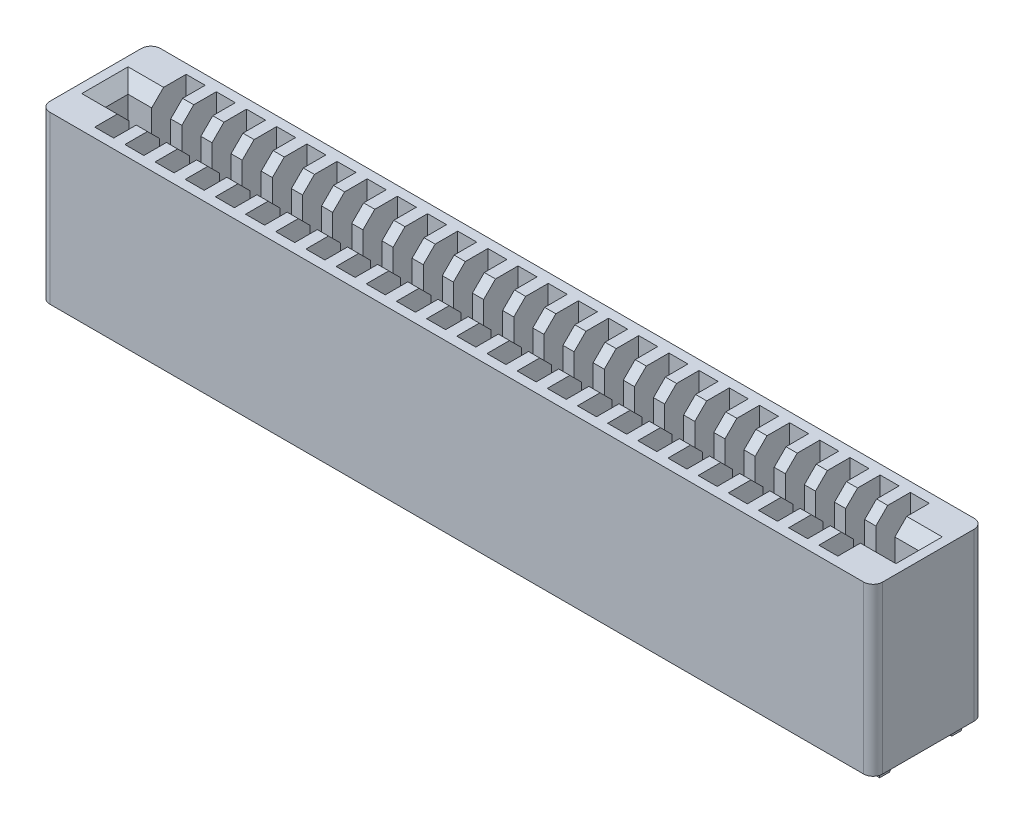
from build123d import *

# Parameters (mm, degrees)
BOSS_EXTRUDE1_DEPTH       = 14
SKETCH2_W                 = 66.54
SKETCH2_H                 = 1.9
CUT_EXTRUDE1_DEPTH        = 7.3
CHAMFER1_SIZE             = 1
SKETCH3_W                 = 1.6
SKETCH3_H                 = 7.7
CUT_EXTRUDE2_DEPTH        = 7.3
LPATTERN1_COUNT           = 25
LPATTERN1_PITCH           = 2.54
SKETCH4_W                 = 1.8
SKETCH4_H                 = 1.3
BOSS_EXTRUDE2_DEPTH       = 0.8
DRAFT5_ANGLE              = 30
DRAFT5_OF_MIRROR1_2_ANGLE = 30
SKETCH5_W                 = 64.2
SKETCH5_H                 = 3
CUT_EXTRUDE3_DEPTH        = 3.5
SKETCH6_W                 = 1
SKETCH6_H                 = 3
BOSS_EXTRUDE3_DEPTH       = 3.5
LPATTERN2_COUNT           = 25
LPATTERN2_PITCH           = 2.54
SKETCH7_W                 = 0.9
SKETCH7_H                 = 0.4
CUT_EXTRUDE4_DEPTH        = 39.027950247
LPATTERN3_COUNT           = 25
LPATTERN3_PITCH           = 2.54
LPATTERN3_COUNT_DIR2      = 2
LPATTERN3_PITCH_DIR2      = 5.08
CUT_EXTRUDE5_DEPTH        = 1.6
LPATTERN4_COUNT           = 25
LPATTERN4_PITCH           = 2.54


# Read off the part's stored shape, not the designer's step: Mirror2
with BuildPart() as part:
    # Sketch1 → Boss-Extrude1 (new body)
    with BuildSketch(Plane(origin=(0, 0, 0), x_dir=(1, 0, 0), z_dir=(0, 1, 0))):
        with BuildLine():
            Line((-34.25, 4.65), (34.25, 4.65))
            ThreePointArc((34.25, 4.65), (34.815685425, 4.415685425), (35.05, 3.85))
            Line((35.05, 3.85), (35.05, -3.85))
            ThreePointArc((35.05, -3.85), (34.815685425, -4.415685425), (34.25, -4.65))
            Line((34.25, -4.65), (-34.25, -4.65))
            ThreePointArc((-34.25, -4.65), (-34.815685425, -4.415685425), (-35.05, -3.85))
            Line((-35.05, -3.85), (-35.05, 3.85))
            ThreePointArc((-35.05, 3.85), (-34.815685425, 4.415685425), (-34.25, 4.65))
        make_face()
    extrude(amount=BOSS_EXTRUDE1_DEPTH)

    # Sketch2 → Cut-Extrude1 (cut)
    with BuildSketch(Plane(origin=(0, 14, 0), x_dir=(1, 0, 0), z_dir=(0, 1, 0))):
        Rectangle(SKETCH2_W, SKETCH2_H)
    extrude(amount=-CUT_EXTRUDE1_DEPTH, mode=Mode.SUBTRACT)

    # Chamfer1
    chamfer1_edges = [part.edges().sort_by_distance(p)[0] for p in [
        (33.27, 14, 0),
        (0, 14, -0.95),
        (-33.27, 14, 0),
        (0, 14, 0.95),
    ]]
    chamfer(chamfer1_edges, length=CHAMFER1_SIZE)

    # Sketch3 → Cut-Extrude2 (cut)
    with BuildSketch(Plane(origin=(0, 14, 0), x_dir=(1, 0, 0), z_dir=(0, 1, 0))):
        with Locations((-30.48, 0)):
            Rectangle(SKETCH3_W, SKETCH3_H)
    cut_extrude2 = extrude(amount=-CUT_EXTRUDE2_DEPTH, mode=Mode.SUBTRACT)

    # LPattern1: Cut-Extrude2 ×25
    with Locations(*[(i * LPATTERN1_PITCH, 0, 0) for i in range(1, LPATTERN1_COUNT)]):
        add(cut_extrude2, mode=Mode.SUBTRACT)

    # Sketch4 → Boss-Extrude2 (add)
    with BuildSketch(Plane.XZ):
        with Locations((-33.5, 2.8)):
            Rectangle(SKETCH4_W, SKETCH4_H)
    boss_extrude2 = extrude(amount=BOSS_EXTRUDE2_DEPTH)

    # Draft5
    draft5_faces = [part.faces().sort_by_distance(p)[0] for p in [
        (-32.6, -0.4, 2.8),
        (-33.5, -0.4, 2.15),
    ]]
    draft(draft5_faces, Plane(origin=(34.25, 0, -3.85), x_dir=(0, 0, -1), z_dir=(0, -1, 0)), DRAFT5_ANGLE)

    # Mirror1: Boss-Extrude2 across plane
    add(boss_extrude2.mirror(Plane(origin=(0, 0, 0), x_dir=(0, 0, 1), z_dir=(1, 0, 0))))

    # Draft5 of Mirror1 2
    draft5_of_mirror1_2_faces = [part.faces().sort_by_distance(p)[0] for p in [
        (32.6, -0.4, 2.8),
        (33.5, -0.4, 2.15),
    ]]
    draft(draft5_of_mirror1_2_faces, Plane(origin=(-34.25, 0, -3.85), x_dir=(0, 0, -1), z_dir=(0, -1, 0)), DRAFT5_OF_MIRROR1_2_ANGLE)

    # Mirror2: part across plane


with BuildPart() as part_1:
    add(part.part)
    add(part.part.mirror(Plane.XY))

    # Sketch5 → Cut-Extrude3 (cut)
    with BuildSketch(Plane.XZ):
        Rectangle(SKETCH5_W, SKETCH5_H)
    extrude(amount=-CUT_EXTRUDE3_DEPTH, mode=Mode.SUBTRACT)

    # Sketch6 → Boss-Extrude3 (add)
    with BuildSketch(Plane.XZ.offset(-3.5)):
        with Locations((-30.48, 0)):
            Rectangle(SKETCH6_W, SKETCH6_H)
    boss_extrude3 = extrude(amount=BOSS_EXTRUDE3_DEPTH)

    # LPattern2: Boss-Extrude3 ×25
    with Locations(*[(i * LPATTERN2_PITCH, 0, 0) for i in range(1, LPATTERN2_COUNT)]):
        add(boss_extrude3)

    # Sketch7 → Cut-Extrude4 (cut, through all)
    with BuildSketch(Plane.XZ):
        with Locations((-30.48, 2.54)):
            Rectangle(SKETCH7_W, SKETCH7_H)
    cut_extrude4 = extrude(amount=-CUT_EXTRUDE4_DEPTH, mode=Mode.SUBTRACT)

    # LPattern3: Cut-Extrude4 25 × 2
    with Locations(*[(i * LPATTERN3_PITCH, 0, -j * LPATTERN3_PITCH_DIR2) for i in range(LPATTERN3_COUNT) for j in range(LPATTERN3_COUNT_DIR2) if (i, j) != (0, 0)]):
        add(cut_extrude4, mode=Mode.SUBTRACT)

    # Sketch8 → Cut-Extrude5 (cut)
    with BuildSketch(Plane(origin=(-31.28, 0, 0), x_dir=(0, 0, -1), z_dir=(1, 0, 0))):
        Polygon((-3.85, 6.7), (-3.85, 5.7), (-2.74, 3.777423604), (-2.34, 3.777423604), (-0.4, 4.7), (-0.4, 6.7), align=None)
        Polygon((0.4, 4.7), (0.4, 6.7), (3.85, 6.7), (3.85, 5.7), (2.74, 3.777423604), (2.34, 3.777423604), align=None)
    cut_extrude5 = extrude(amount=CUT_EXTRUDE5_DEPTH, mode=Mode.SUBTRACT)

    # LPattern4: Cut-Extrude5 ×25
    with Locations(*[(i * LPATTERN4_PITCH, 0, 0) for i in range(1, LPATTERN4_COUNT)]):
        add(cut_extrude5, mode=Mode.SUBTRACT)


solid = part_1.part
